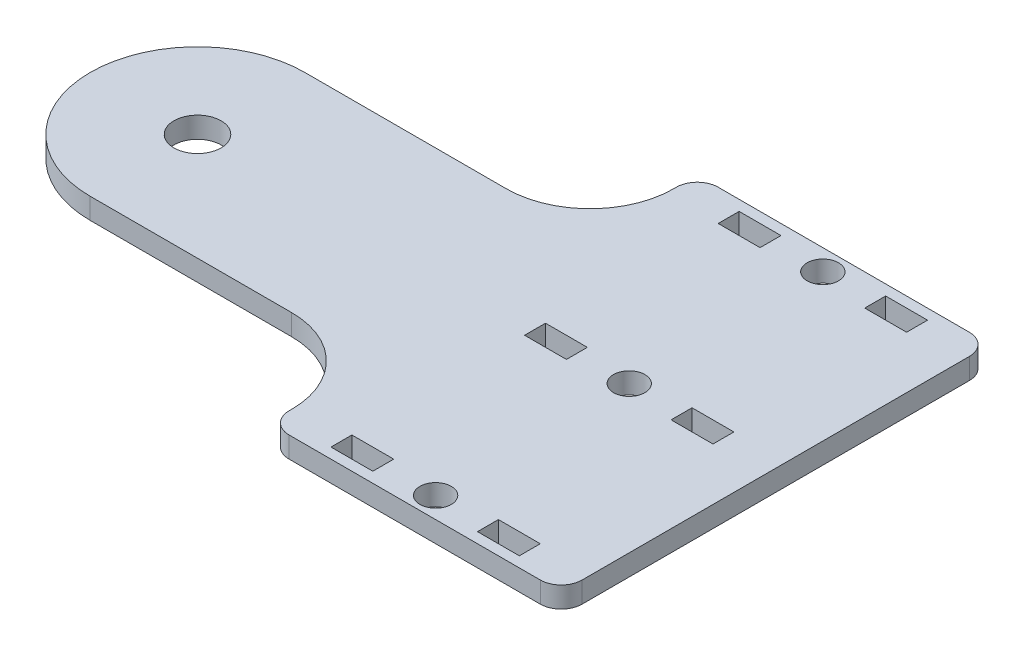
from build123d import *

# Parameters (mm, degrees)
SKETCH1_R           = 2.25
BOSS_EXTRUDE1_DEPTH = 2
FILLET1_R           = 10.25
FILLET2_R           = 2
SKETCH2_R           = 1.5
SKETCH2_W           = 4
SKETCH2_H           = 2
CUT_EXTRUDE1_DEPTH  = 2
FILLET3_R           = 8


with BuildPart() as part:
    # Sketch1 → Boss-Extrude1 (new body)
    with BuildSketch(Plane(origin=(0, 0, 0), x_dir=(1, 0, 0), z_dir=(0, 1, 0))):
        Polygon((0, 0), (37.5, 0), (37.5, -10.25), (65.5, -10.25), (65.5, -0.75), (65.5, 21.25), (65.5, 30.75), (37.5, 30.75), (37.5, 20.5), (0, 20.5), align=None)
        with Locations(Location((10.25, 10.25, 0), (0, 0, 270))):
            Circle(SKETCH1_R, mode=Mode.SUBTRACT)
    extrude(amount=BOSS_EXTRUDE1_DEPTH)

    # Fillet1
    fillet1_edges = [part.edges().sort_by_distance(p)[0] for p in [
        (0, 1, -20.5),
        (0, 1, 0),
    ]]
    fillet(fillet1_edges, radius=FILLET1_R - 0.0001)  # a hair under: the kernel refuses the full size

    # Fillet2
    fillet2_edges = [part.edges().sort_by_distance(p)[0] for p in [
        (37.5, 1, -30.75),
        (65.5, 1, -30.75),
        (65.5, 1, 10.25),
        (37.5, 1, 10.25),
    ]]
    fillet(fillet2_edges, radius=FILLET2_R)

    # Sketch2 → Cut-Extrude1 (cut)
    with BuildSketch(Plane(origin=(0, 2, 0), x_dir=(1, 0, 0), z_dir=(0, 1, 0))):
        with Locations(Location((51.5, 28.75, 0), (0, 0, 270))):
            Circle(SKETCH2_R)
        with Locations(Location((51.5, 10.25, 0), (0, 0, 270))):
            Circle(SKETCH2_R)
        with Locations(Location((51.5, -8.25, 0), (0, 0, 270))):
            Circle(SKETCH2_R)
        with Locations((44.5, 28.75)):
            Rectangle(SKETCH2_W, SKETCH2_H)
        with Locations((58.5, 28.75)):
            Rectangle(SKETCH2_W, SKETCH2_H)
        with Locations((44.5, 10.25)):
            Rectangle(SKETCH2_W, SKETCH2_H)
        with Locations((58.5, 10.25)):
            Rectangle(SKETCH2_W, SKETCH2_H)
        with Locations((44.5, -8.25)):
            Rectangle(SKETCH2_W, SKETCH2_H)
        with Locations((58.5, -8.25)):
            Rectangle(SKETCH2_W, SKETCH2_H)
    extrude(amount=-CUT_EXTRUDE1_DEPTH, mode=Mode.SUBTRACT)

    # Fillet3
    fillet3_edges = [part.edges().sort_by_distance(p)[0] for p in [
        (37.5, 1, -20.5),
        (37.5, 1, 0),
    ]]
    fillet(fillet3_edges, radius=FILLET3_R)


solid = part.part
